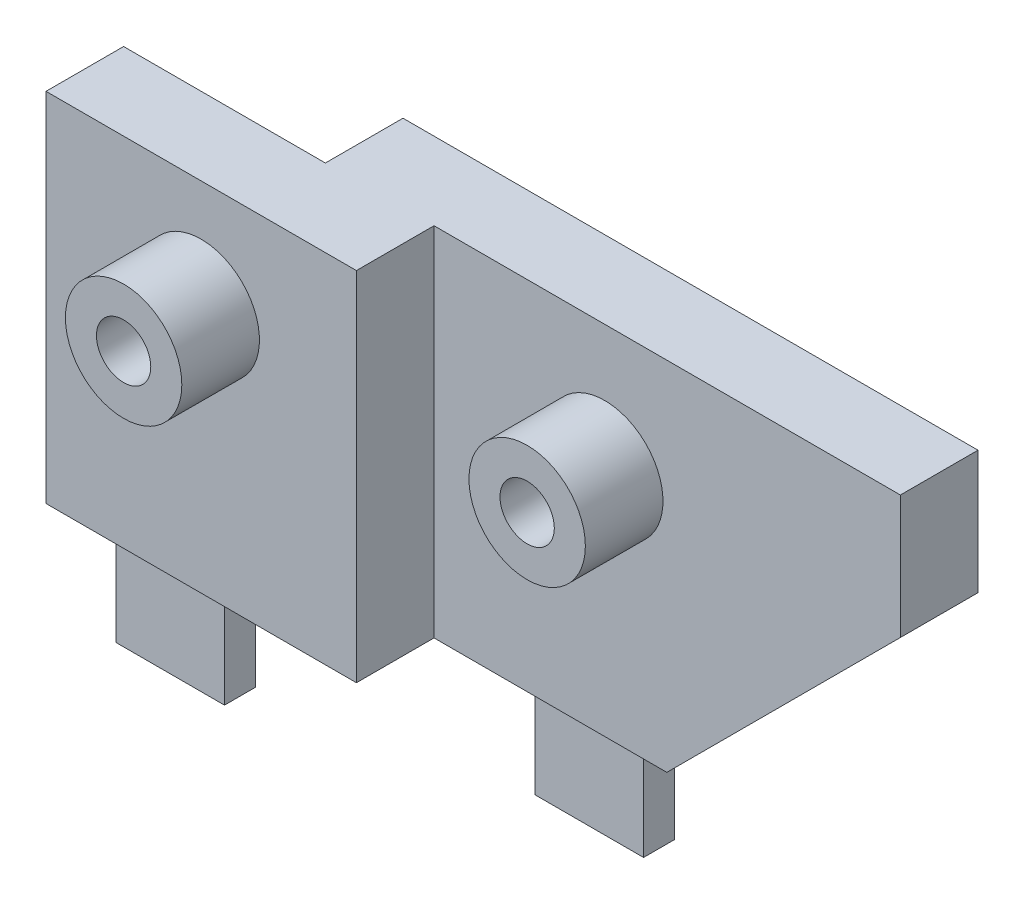
from build123d import *

# Parameters (mm, degrees)
BOSS_EXTRUDE1_DEPTH = 23
SKETCH2_R           = 1.75
CUT_EXTRUDE1_DEPTH  = 44.058100283
SKETCH3_R           = 1.5
CUT_EXTRUDE2_DEPTH  = 10
SKETCH4_W           = 7
SKETCH4_H           = 2
BOSS_EXTRUDE2_DEPTH = 7
BOSS_EXTRUDE3_START = 5
SKETCH5_R           = 3.75
SKETCH5_R_2         = 1.75
BOSS_EXTRUDE3_DEPTH = 5
BOSS_EXTRUDE4_START = 5
SKETCH6_R           = 3.75
SKETCH6_R_2         = 1.75
BOSS_EXTRUDE4_DEPTH = 5
BOSS_EXTRUDE5_DEPTH = 5


with BuildPart() as part:
    # Sketch1 → Boss-Extrude1 (new body)
    with BuildSketch(Plane(origin=(0, 0, 0), x_dir=(1, 0, 0), z_dir=(0, 1, 0))):
        Polygon((0, 0), (-18, 0), (-22, 0), (-22, -5), (-35, -5), (-35, -10), (-15, -10), (-15, -5), (0, -5), align=None)
    extrude(amount=BOSS_EXTRUDE1_DEPTH)

    # Sketch2 → Cut-Extrude1 (cut, through all)
    with BuildSketch(Plane.XY.offset(10)):
        with Locations((-25, 16)):
            Circle(SKETCH2_R)
        with Locations((-4, 15)):
            Circle(SKETCH2_R)
    extrude(amount=-CUT_EXTRUDE1_DEPTH, mode=Mode.SUBTRACT)

    # Sketch3 → Cut-Extrude2 (cut)
    with BuildSketch(Plane.XZ):
        with Locations((-18.5, 5)):
            Circle(SKETCH3_R)
    extrude(amount=-CUT_EXTRUDE2_DEPTH, mode=Mode.SUBTRACT)

    # Sketch4 → Boss-Extrude2 (add)
    with BuildSketch(Plane.XZ):
        with Locations((-6.5, 2.5)):
            Rectangle(SKETCH4_W, SKETCH4_H)
        with Locations((-28.5, 7.5)):
            Rectangle(SKETCH4_W, SKETCH4_H)
    extrude(amount=BOSS_EXTRUDE2_DEPTH)

    # Sketch5 → Boss-Extrude3 (add)
    with BuildSketch(Plane.XY.offset(10).offset(BOSS_EXTRUDE3_START)):
        with Locations((-25, 16)):
            Circle(SKETCH5_R)
        with Locations((-25, 16)):
            Circle(SKETCH5_R_2, mode=Mode.SUBTRACT)
    extrude(amount=-BOSS_EXTRUDE3_DEPTH)

    # Sketch6 → Boss-Extrude4 (add)
    with BuildSketch(Plane.XY.offset(5).offset(BOSS_EXTRUDE4_START)):
        with Locations((-4, 15)):
            Circle(SKETCH6_R)
        with Locations((-4, 15)):
            Circle(SKETCH6_R_2, mode=Mode.SUBTRACT)
    extrude(amount=-BOSS_EXTRUDE4_DEPTH)

    # Sketch7 → Boss-Extrude5 (add)
    with BuildSketch(Plane.XY.offset(5)):
        Polygon((0, 0), (0, 23), (15.047232304, 23), (15.047232304, 15.047232304), align=None)
    extrude(amount=-BOSS_EXTRUDE5_DEPTH)


solid = part.part
